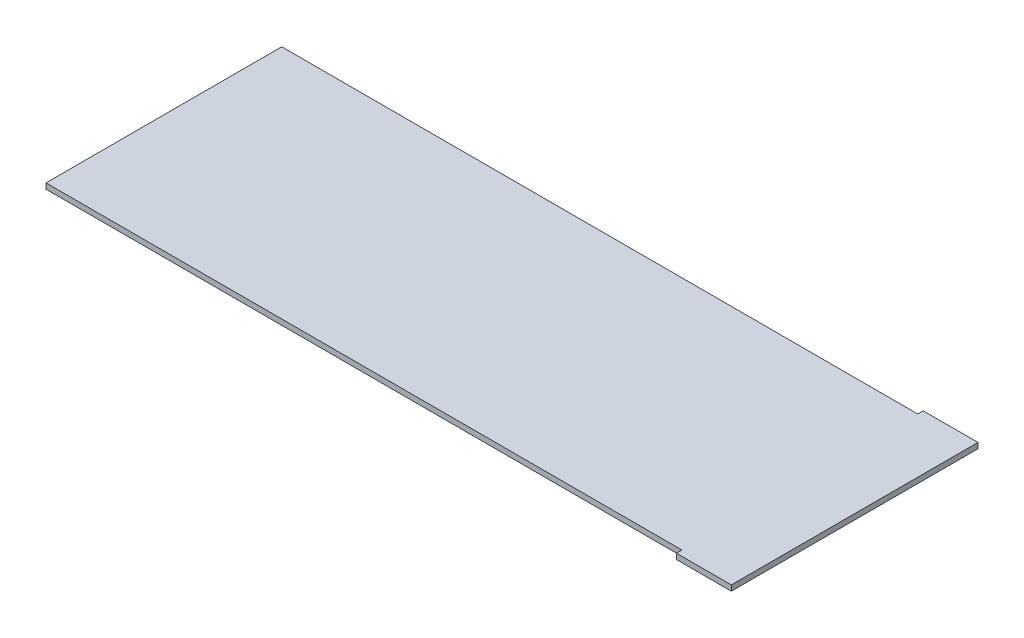
from build123d import *

# Parameters (mm, degrees)
BOSS_EXTRUDE1_DEPTH = 1.5875


with BuildPart() as part:
    # Sketch1 → Boss-Extrude1 (new, symmetric)
    with BuildSketch(Plane(origin=(0, 0, 0), x_dir=(1, 0, 0), z_dir=(0, 1, 0))):
        Polygon((200.025, 71.4375), (168.275, 71.4375), (168.275, 68.2625), (-200.025, 68.2625), (-200.025, -68.2625), (168.275, -68.2625), (168.275, -71.4375), (200.025, -71.4375), align=None)
    extrude(amount=BOSS_EXTRUDE1_DEPTH, both=True)


solid = part.part
